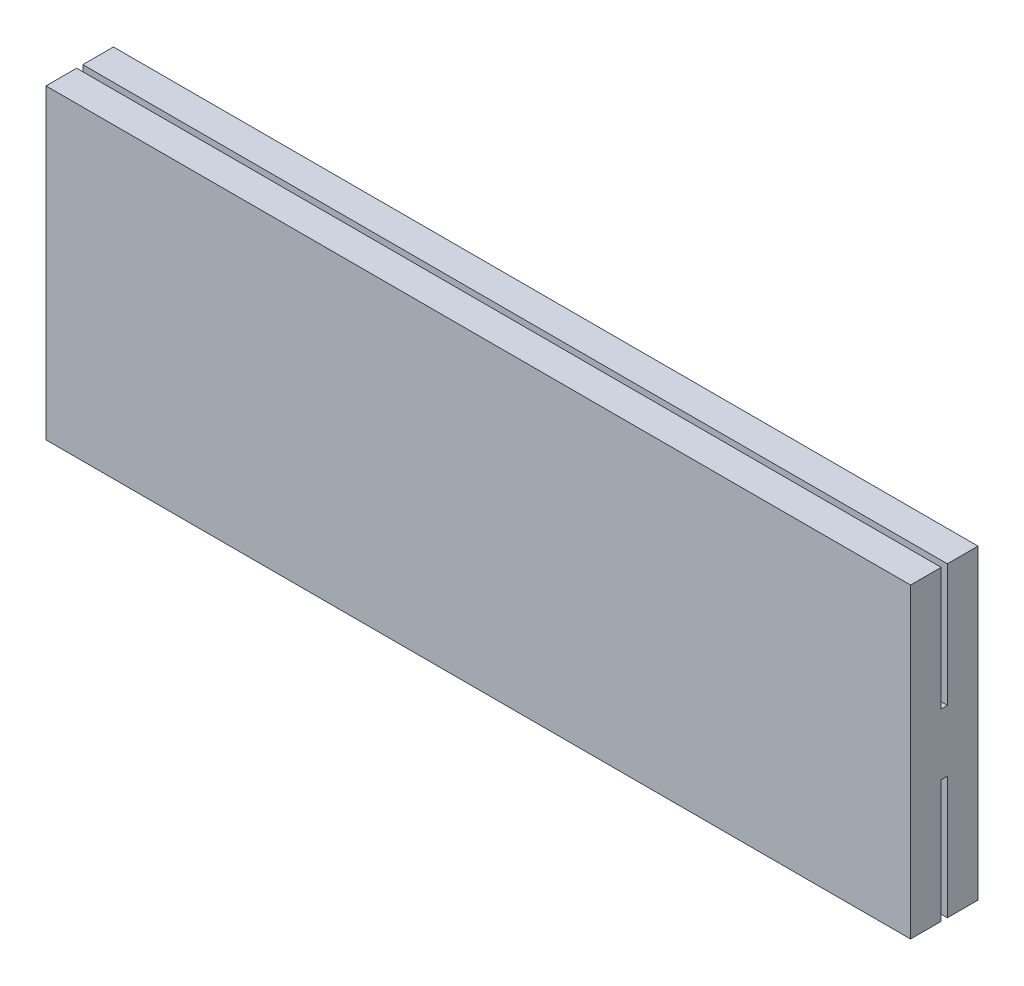
from build123d import *

# Parameters (mm, degrees)
BOSS_EXTRUDE1_DEPTH      = 141
BOSS_EXTRUDE1_DEPTH_BACK = 141
SKETCH1_W                = 22
SKETCH1_H                = 100
CAVITY1_START            = -2
CAVITY1_OUTLINE_W        = 282
CAVITY1_OUTLINE_H        = 40
CAVITY1_DEPTH            = 2


# Read off the part's stored shape, not the designer's step: Cavity1
with BuildPart() as part:
    # Sketch1 → Boss-Extrude1 (new, two sides: drawn at the far end of the back side and taken through both)
    with BuildSketch(Plane(origin=(0, 0, 0), x_dir=(0, 0, -1), z_dir=(1, 0, 0)).offset(-BOSS_EXTRUDE1_DEPTH_BACK)):
        with Locations((1, -190)):
            Rectangle(SKETCH1_W, SKETCH1_H)
    extrude(amount=BOSS_EXTRUDE1_DEPTH + BOSS_EXTRUDE1_DEPTH_BACK)

    # Cavity1 outline → Cavity1 (cut)
    with BuildSketch(Plane.XY.offset(CAVITY1_START)):
        with Locations((0, -160)):
            Rectangle(CAVITY1_OUTLINE_W, CAVITY1_OUTLINE_H)
    cavity1 = extrude(amount=CAVITY1_DEPTH, mode=Mode.SUBTRACT)

    # Mirror1: Cavity1 across plane
    add(cavity1.mirror(Plane.ZX.offset(-190)), mode=Mode.SUBTRACT)


solid = part.part
